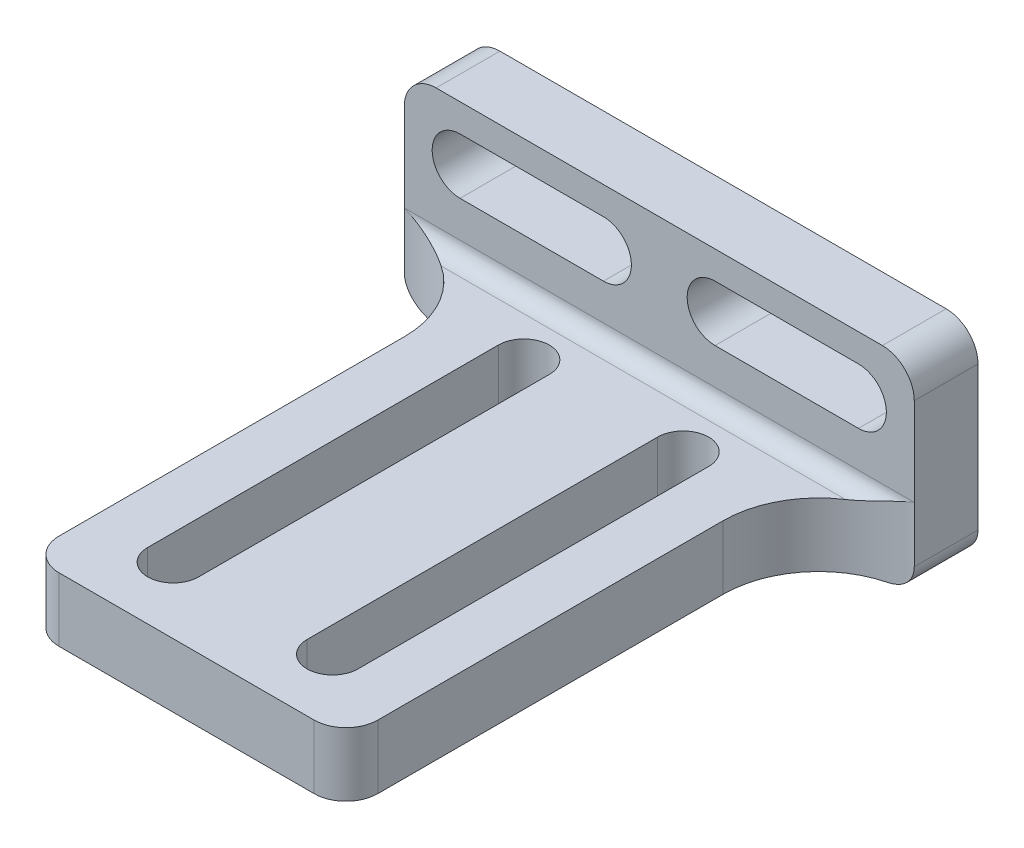
from build123d import *

# Parameters (mm, degrees)
EXTRUDE_1_DEPTH           = 3
SKETCH_7_R                = 2.25
CUT_EXTRUDE_2_DEPTH       = 143.955430949
SKETCH_8_R                = 8
CUT_EXTRUDE_3_DEPTH       = 143.955430949
CUT_EXTRUDE_4_DEPTH       = 3
CUT_EXTRUDE_5_DEPTH       = 3
CUT_EXTRUDE_8_DEPTH       = 3
SKETCH_12_R               = 1.7
CUT_EXTRUDE_9_DEPTH       = 3
SKETCH_13_R               = 1.7
CUT_EXTRUDE_11_DEPTH      = 3
CUT_EXTRUDE_12_DEPTH      = 143.955430949
FILLET_1_R                = 2
FILLET_2_R                = 2
CUT_EXTRUDE_13_DEPTH      = 143.955430949
CUT_EXTRUDE_14_DEPTH      = 143.955430949
CUT_EXTRUDE_15_DEPTH      = 143.955430949
CUT_EXTRUDE_16_DEPTH      = 143.955430949
EXTRUDE_2_DEPTH           = 4
EXTRUDE_2_2_DEPTH         = 4
EXTRUDE_4_DEPTH           = 4
EXTRUDE_5_DEPTH           = 35
SKETCH_25_W               = 6
SKETCH_25_H               = 31
CUT_EXTRUDE_17_DEPTH      = 5
FILLET_3_R                = 6
FILLET_4_R                = 6
FILLET_5_R                = 1.5
FILLET_6_R                = 1.5
CUT_EXTRUDE_18_DEPTH      = 5
CUT_EXTRUDE_19_DEPTH      = 15
CUT_EXTRUDE_19_DEPTH_BACK = 95
SKETCH_27_W               = 31
SKETCH_27_H               = 1
FILLET_8_R                = 1
FILLET_9_R                = 1
FILLET_10_R               = 3
SKETCH_28_W               = 85
SKETCH_28_H               = 10.343066278
CUT_EXTRUDE_20_DEPTH      = 5
FILLET_12_R               = 3
FILLET_13_R               = 3
EXTRUDE_7_DEPTH           = 4
FILLET_14_R               = 2
FILLET_15_R               = 2
SKETCH_33_W               = 46.51678315
SKETCH_33_H               = 37.006685261
CUT_EXTRUDE_22_DEPTH      = 40
SKETCH_34_W               = 20
SKETCH_34_H               = 12
EXTRUDE_8_DEPTH           = 4
CUT_EXTRUDE_23_DEPTH      = 10
FILLET_17_R               = 2


# Read off the part's stored shape, not the designer's step: 切除-拉伸21
# Some blends are built 0.0001 mm under size
with BuildPart() as part:
    # 草图1 → 凸台-拉伸1 (new body)
    # profile 1 of 14: a face of its own
    with BuildSketch(Plane.XY):
        with BuildLine():
            Line((60, 106.603296002), (35.889163634, 121.664519159))
            Line((35.889163634, 121.664519159), (-35.889163634, 121.664519159))
            Line((-35.889163634, 121.664519159), (-60, 106.603296002))
            Line((-60, 106.603296002), (-60, 94.801892265))
            Line((-60, 94.801892265), (-45, 94.801892265))
            ThreePointArc((-45, 94.801892265), (-43.762563133, 94.289329132), (-43.25, 93.051892265))
            Line((-43.25, 93.051892265), (-37.75, 93.051892265))
            ThreePointArc((-37.75, 93.051892265), (-37.237436867, 94.289329132), (-36, 94.801892265))
            Line((-36, 94.801892265), (-21, 94.801892265))
            ThreePointArc((-21, 94.801892265), (-19.762563133, 94.289329132), (-19.25, 93.051892265))
            Line((-19.25, 93.051892265), (19.25, 93.051892265))
            ThreePointArc((19.25, 93.051892265), (19.762563133, 94.289329132), (21, 94.801892265))
            Line((21, 94.801892265), (36, 94.801892265))
            ThreePointArc((36, 94.801892265), (37.237436867, 94.289329132), (37.75, 93.051892265))
            Line((37.75, 93.051892265), (43.25, 93.051892265))
            ThreePointArc((43.25, 93.051892265), (43.762563133, 94.289329132), (45, 94.801892265))
            Line((45, 94.801892265), (60, 94.801892265))
            Line((60, 94.801892265), (60, 106.603296002))
        make_face()
    # profile 2 of 14: a face of its own
    with BuildSketch(Plane.XY):
        with BuildLine():
            Line((66.901694095, 102.292041372), (60, 106.603296002))
            Line((60, 106.603296002), (60, 94.801892265))
            ThreePointArc((60, 94.801892265), (61.237436867, 94.289329132), (61.75, 93.051892265))
            Line((61.75, 93.051892265), (66.901694095, 93.051892265))
            Line((66.901694095, 93.051892265), (66.901694095, 102.292041372))
        make_face()
    # profile 3 of 14: a face of its own
    with BuildSketch(Plane.XY):
        with BuildLine():
            Line((-60, 94.801892265), (-60, 106.603296002))
            Line((-60, 106.603296002), (-66.901694095, 102.292041372))
            Line((-66.901694095, 102.292041372), (-66.901694095, 93.051892265))
            Line((-66.901694095, 93.051892265), (-61.75, 93.051892265))
            ThreePointArc((-61.75, 93.051892265), (-61.237436867, 94.289329132), (-60, 94.801892265))
        make_face()
    # profile 4 of 14: a face of its own
    with BuildSketch(Plane.XY):
        with BuildLine():
            Line((66.901694095, 63.051892265), (66.901694095, 93.051892265))
            Line((66.901694095, 93.051892265), (61.75, 93.051892265))
            ThreePointArc((61.75, 93.051892265), (61.237436867, 91.814455398), (60, 91.301892265))
            Line((60, 91.301892265), (60, 64.801892265))
            ThreePointArc((60, 64.801892265), (61.237436867, 64.289329132), (61.75, 63.051892265))
            Line((61.75, 63.051892265), (66.901694095, 63.051892265))
        make_face()
    # profile 5 of 14: a face of its own
    with BuildSketch(Plane.XY):
        with BuildLine():
            Line((-61.75, 93.051892265), (-66.901694095, 93.051892265))
            Line((-66.901694095, 93.051892265), (-66.901694095, 63.051892265))
            Line((-66.901694095, 63.051892265), (-61.75, 63.051892265))
            ThreePointArc((-61.75, 63.051892265), (-61.237436867, 64.289329132), (-60, 64.801892265))
            Line((-60, 64.801892265), (-60, 91.301892265))
            ThreePointArc((-60, 91.301892265), (-61.237436867, 91.814455398), (-61.75, 93.051892265))
        make_face()
    # profile 6 of 14: a face of its own
    with BuildSketch(Plane.XY):
        with BuildLine():
            Line((66.901694095, 52.870133869), (66.901694095, 63.051892265))
            Line((66.901694095, 63.051892265), (61.75, 63.051892265))
            ThreePointArc((61.75, 63.051892265), (61.237436867, 61.814455398), (60, 61.301892265))
            Line((60, 61.301892265), (60, 31.261343001))
            Line((60, 31.261343001), (75, 31.261343001))
            Line((75, 31.261343001), (75, 40.933889795))
            ThreePointArc((75, 40.933889795), (69.117351927, 45.658052319), (66.901694095, 52.870133869))
        make_face()
    # profile 7 of 14: a face of its own
    with BuildSketch(Plane.XY):
        with BuildLine():
            Line((60, 64.801892265), (60, 91.301892265))
            Line((60, 91.301892265), (45, 91.301892265))
            ThreePointArc((45, 91.301892265), (43.762563133, 91.814455398), (43.25, 93.051892265))
            Line((43.25, 93.051892265), (37.75, 93.051892265))
            ThreePointArc((37.75, 93.051892265), (37.237436867, 91.814455398), (36, 91.301892265))
            Line((36, 91.301892265), (21, 91.301892265))
            ThreePointArc((21, 91.301892265), (19.762563133, 91.814455398), (19.25, 93.051892265))
            Line((19.25, 93.051892265), (-19.25, 93.051892265))
            ThreePointArc((-19.25, 93.051892265), (-19.762563133, 91.814455398), (-21, 91.301892265))
            Line((-21, 91.301892265), (-36, 91.301892265))
            ThreePointArc((-36, 91.301892265), (-37.237436867, 91.814455398), (-37.75, 93.051892265))
            Line((-37.75, 93.051892265), (-43.25, 93.051892265))
            ThreePointArc((-43.25, 93.051892265), (-43.762563133, 91.814455398), (-45, 91.301892265))
            Line((-45, 91.301892265), (-60, 91.301892265))
            Line((-60, 91.301892265), (-60, 64.801892265))
            Line((-60, 64.801892265), (-45, 64.801892265))
            ThreePointArc((-45, 64.801892265), (-43.762563133, 64.289329132), (-43.25, 63.051892265))
            Line((-43.25, 63.051892265), (-37.75, 63.051892265))
            ThreePointArc((-37.75, 63.051892265), (-37.237436867, 64.289329132), (-36, 64.801892265))
            Line((-36, 64.801892265), (-21, 64.801892265))
            ThreePointArc((-21, 64.801892265), (-19.762563133, 64.289329132), (-19.25, 63.051892265))
            Line((-19.25, 63.051892265), (19.25, 63.051892265))
            ThreePointArc((19.25, 63.051892265), (19.762563133, 64.289329132), (21, 64.801892265))
            Line((21, 64.801892265), (36, 64.801892265))
            ThreePointArc((36, 64.801892265), (37.237436867, 64.289329132), (37.75, 63.051892265))
            Line((37.75, 63.051892265), (43.25, 63.051892265))
            ThreePointArc((43.25, 63.051892265), (43.762563133, 64.289329132), (45, 64.801892265))
            Line((45, 64.801892265), (60, 64.801892265))
        make_face()
    # profile 8 of 14: a face of its own
    with BuildSketch(Plane.XY):
        with BuildLine():
            Line((-61.75, 63.051892265), (-66.901694095, 63.051892265))
            Line((-66.901694095, 63.051892265), (-66.901694095, 52.870133869))
            ThreePointArc((-66.901694095, 52.870133869), (-69.117351927, 45.658052319), (-75, 40.933889795))
            Line((-75, 40.933889795), (-75, 31.261343001))
            Line((-75, 31.261343001), (-60, 31.261343001))
            Line((-60, 31.261343001), (-60, 61.301892265))
            ThreePointArc((-60, 61.301892265), (-61.237436867, 61.814455398), (-61.75, 63.051892265))
        make_face()
    # profile 9 of 14: a face of its own
    with BuildSketch(Plane.XY):
        with BuildLine():
            Line((60, 31.261343001), (60, 61.301892265))
            Line((60, 61.301892265), (45, 61.301892265))
            ThreePointArc((45, 61.301892265), (43.762563133, 61.814455398), (43.25, 63.051892265))
            Line((43.25, 63.051892265), (37.75, 63.051892265))
            ThreePointArc((37.75, 63.051892265), (37.237436867, 61.814455398), (36, 61.301892265))
            Line((36, 61.301892265), (21, 61.301892265))
            ThreePointArc((21, 61.301892265), (19.762563133, 61.814455398), (19.25, 63.051892265))
            Line((19.25, 63.051892265), (-19.25, 63.051892265))
            ThreePointArc((-19.25, 63.051892265), (-19.762563133, 61.814455398), (-21, 61.301892265))
            Line((-21, 61.301892265), (-36, 61.301892265))
            ThreePointArc((-36, 61.301892265), (-37.237436867, 61.814455398), (-37.75, 63.051892265))
            Line((-37.75, 63.051892265), (-43.25, 63.051892265))
            ThreePointArc((-43.25, 63.051892265), (-43.762563133, 61.814455398), (-45, 61.301892265))
            Line((-45, 61.301892265), (-60, 61.301892265))
            Line((-60, 61.301892265), (-60, 31.261343001))
            Line((-60, 31.261343001), (60, 31.261343001))
        make_face()
    # profile 10 of 14: a face of its own
    with BuildSketch(Plane.XY):
        with BuildLine():
            Line((60, -58.312864289), (60, 23.940028391))
            Line((60, 23.940028391), (-60, 23.940028391))
            Line((-60, 23.940028391), (-60, -58.312864289))
            Line((-60, -58.312864289), (-45, -58.312864289))
            ThreePointArc((-45, -58.312864289), (-43.25, -60.062864289), (-45, -61.812864289))
            Line((-45, -61.812864289), (-60, -61.812864289))
            Line((-60, -61.812864289), (-60, -88.312864289))
            Line((-60, -88.312864289), (-45, -88.312864289))
            ThreePointArc((-45, -88.312864289), (-43.25, -90.062864289), (-45, -91.812864289))
            Line((-45, -91.812864289), (-60, -91.812864289))
            Line((-60, -91.812864289), (-60, -111.849967256))
            Line((-60, -111.849967256), (-38.845469114, -105.590576733))
            ThreePointArc((-38.845469114, -105.590576733), (-36.037784492, -104.975210108), (-33.17088573, -104.768665882))
            Line((-33.17088573, -104.768665882), (33.17088573, -104.768665882))
            ThreePointArc((33.17088573, -104.768665882), (36.037784492, -104.975210108), (38.845469114, -105.590576733))
            Line((38.845469114, -105.590576733), (60, -111.849967256))
            Line((60, -111.849967256), (60, -91.812864289))
            Line((60, -91.812864289), (45, -91.812864289))
            ThreePointArc((45, -91.812864289), (43.762563133, -91.300301156), (43.25, -90.062864289))
            ThreePointArc((43.25, -90.062864289), (43.762563133, -88.825427422), (45, -88.312864289))
            Line((45, -88.312864289), (60, -88.312864289))
            Line((60, -88.312864289), (60, -61.812864289))
            Line((60, -61.812864289), (45, -61.812864289))
            ThreePointArc((45, -61.812864289), (43.762563133, -61.300301156), (43.25, -60.062864289))
            ThreePointArc((43.25, -60.062864289), (43.762563133, -58.825427422), (45, -58.312864289))
            Line((45, -58.312864289), (60, -58.312864289))
        make_face()
        with BuildLine():
            ThreePointArc((-21, -88.312864289), (-19.762563133, -88.825427422), (-19.25, -90.062864289))
            ThreePointArc((-19.25, -90.062864289), (-19.762563133, -91.300301156), (-21, -91.812864289))
            Line((-21, -91.812864289), (-36, -91.812864289))
            ThreePointArc((-36, -91.812864289), (-37.75, -90.062864289), (-36, -88.312864289))
            Line((-36, -88.312864289), (-21, -88.312864289))
        make_face(mode=Mode.SUBTRACT)
        with BuildLine():
            ThreePointArc((-21, -58.312864289), (-19.762563133, -58.825427422), (-19.25, -60.062864289))
            ThreePointArc((-19.25, -60.062864289), (-19.762563133, -61.300301156), (-21, -61.812864289))
            Line((-21, -61.812864289), (-36, -61.812864289))
            ThreePointArc((-36, -61.812864289), (-37.75, -60.062864289), (-36, -58.312864289))
            Line((-36, -58.312864289), (-21, -58.312864289))
        make_face(mode=Mode.SUBTRACT)
        with BuildLine():
            ThreePointArc((36, -88.312864289), (37.237436867, -88.825427422), (37.75, -90.062864289))
            ThreePointArc((37.75, -90.062864289), (37.237436867, -91.300301156), (36, -91.812864289))
            Line((36, -91.812864289), (21, -91.812864289))
            ThreePointArc((21, -91.812864289), (19.762563133, -91.300301156), (19.25, -90.062864289))
            ThreePointArc((19.25, -90.062864289), (19.762563133, -88.825427422), (21, -88.312864289))
            Line((21, -88.312864289), (36, -88.312864289))
        make_face(mode=Mode.SUBTRACT)
        with BuildLine():
            ThreePointArc((36, -58.312864289), (37.237436867, -58.825427422), (37.75, -60.062864289))
            ThreePointArc((37.75, -60.062864289), (37.237436867, -61.300301156), (36, -61.812864289))
            Line((36, -61.812864289), (21, -61.812864289))
            ThreePointArc((21, -61.812864289), (19.762563133, -61.300301156), (19.25, -60.062864289))
            ThreePointArc((19.25, -60.062864289), (19.762563133, -58.825427422), (21, -58.312864289))
            Line((21, -58.312864289), (36, -58.312864289))
        make_face(mode=Mode.SUBTRACT)
    # profile 11 of 14: a face of its own
    with BuildSketch(Plane.XY):
        with BuildLine():
            Line((75, 23.940028391), (60, 23.940028391))
            Line((60, 23.940028391), (60, -58.312864289))
            ThreePointArc((60, -58.312864289), (61.237436867, -58.825427422), (61.75, -60.062864289))
            Line((61.75, -60.062864289), (67.402721334, -60.062864289))
            add(Edge.make_bspline(
                [(75, 10.562559835), (72.695878257, 1.907314233), (70.339582535, -13.372796253), (67.818206704, -36.939032951), (67.208860388, -51.77269444), (67.402721334, -60.062864289)],
                knots=[0, 0, 0, 0, 0.235246678, 0.40629419, 0.624108181, 0.624108181, 0.624108181, 0.624108181], degree=3))
            Line((75, 10.562559835), (75, 23.940028391))
        make_face()
    # profile 12 of 14: a face of its own
    with BuildSketch(Plane.XY):
        with BuildLine():
            Line((-60, -58.312864289), (-60, 23.940028391))
            Line((-60, 23.940028391), (-75, 23.940028391))
            Line((-75, 23.940028391), (-75, 10.562559835))
            add(Edge.make_bspline(
                [(-75, 10.562559835), (-72.695878257, 1.907314233), (-70.339582535, -13.372796253), (-67.818206704, -36.939032951), (-67.208860388, -51.77269444), (-67.402721334, -60.062864289)],
                knots=[0, 0, 0, 0, 0.235246678, 0.40629419, 0.624108181, 0.624108181, 0.624108181, 0.624108181], degree=3))
            add(Edge.make_bspline(
                [(-67.402721334, -60.062864289), (-67.560325872, -66.802583754), (-68.323504015, -76.843670093), (-70.154131955, -86.778530076), (-70.533712858, -90.062864289)],
                knots=[0.624108181, 0.624108181, 0.624108181, 0.624108181, 0.801186001, 0.888408652, 0.888408652, 0.888408652, 0.888408652], degree=3))
            add(Edge.make_bspline(
                [(-70.533712858, -90.062864289), (-71.019342956, -94.264792095), (-71.137422935, -98.476048206), (-70.1742624, -102.732794059)],
                knots=[0.888408652, 0.888408652, 0.888408652, 0.888408652, 1, 1, 1, 1], degree=3))
            Line((-70.1742624, -102.732794059), (-66.460817635, -113.761651372))
            Line((-66.460817635, -113.761651372), (-60, -111.849967256))
            Line((-60, -111.849967256), (-60, -91.812864289))
            ThreePointArc((-60, -91.812864289), (-61.75, -90.062864289), (-60, -88.312864289))
            Line((-60, -88.312864289), (-60, -61.812864289))
            ThreePointArc((-60, -61.812864289), (-61.75, -60.062864289), (-60, -58.312864289))
        make_face()
    # profile 13 of 14: a face of its own
    with BuildSketch(Plane.XY):
        with BuildLine():
            Line((67.402721334, -60.062864289), (61.75, -60.062864289))
            ThreePointArc((61.75, -60.062864289), (61.237436867, -61.300301156), (60, -61.812864289))
            Line((60, -61.812864289), (60, -88.312864289))
            ThreePointArc((60, -88.312864289), (61.237436867, -88.825427422), (61.75, -90.062864289))
            Line((61.75, -90.062864289), (70.533712858, -90.062864289))
            add(Edge.make_bspline(
                [(67.402721334, -60.062864289), (67.560325872, -66.802583754), (68.323504015, -76.843670093), (70.154131955, -86.778530076), (70.533712858, -90.062864289)],
                knots=[0.624108181, 0.624108181, 0.624108181, 0.624108181, 0.801186001, 0.888408652, 0.888408652, 0.888408652, 0.888408652], degree=3))
        make_face()
    # profile 14 of 14: a face of its own
    with BuildSketch(Plane.XY):
        with BuildLine():
            add(Edge.make_bspline(
                [(70.533712858, -90.062864289), (71.019342956, -94.264792095), (71.137422935, -98.476048206), (70.1742624, -102.732794059)],
                knots=[0.888408652, 0.888408652, 0.888408652, 0.888408652, 1, 1, 1, 1], degree=3))
            Line((70.533712858, -90.062864289), (61.75, -90.062864289))
            ThreePointArc((61.75, -90.062864289), (61.237436867, -91.300301156), (60, -91.812864289))
            Line((60, -91.812864289), (60, -111.849967256))
            Line((60, -111.849967256), (66.460817635, -113.761651372))
            Line((66.460817635, -113.761651372), (70.1742624, -102.732794059))
        make_face()
    extrude(amount=EXTRUDE_1_DEPTH)

    # 草图7 → 切除-拉伸2 (cut, through all)
    with BuildSketch(Plane(origin=(0, 0, 0), x_dir=(-1, 0, 0), z_dir=(0, 0, -1))):
        with Locations((-21, 41.261343001)):
            Circle(SKETCH_7_R)
        with Locations((21, 41.261343001)):
            Circle(SKETCH_7_R)
        with Locations((-21, 13.940028391)):
            Circle(SKETCH_7_R)
        with Locations((21, 13.940028391)):
            Circle(SKETCH_7_R)
    extrude(amount=-CUT_EXTRUDE_2_DEPTH, mode=Mode.SUBTRACT)

    # 草图8 → 切除-拉伸3 (cut, through all)
    with BuildSketch(Plane.XY.offset(3)):
        with BuildLine():
            Line((-12.621438714, -0.378557945), (-33.409010345, 20.409013685))
            ThreePointArc((-33.409010345, 20.409013685), (-36.590999434, 20.409013643), (-36.590999309, 17.227024553))
            Line((-36.590999309, 17.227024553), (-15.803426586, -3.560545984))
            ThreePointArc((-15.803426586, -3.560545984), (-12.621438673, -3.560545859), (-12.621438714, -0.378557945))
        make_face()
        with BuildLine():
            Line((33.410462056, 20.410458798), (12.572988319, -0.427010824))
            ThreePointArc((12.572988319, -0.427010824), (12.644570441, -3.584764993), (15.803045702, -3.56090242))
            Line((15.803045702, -3.56090242), (34.999999982, 15.636052774))
            Line((34.999999982, 15.636052774), (36.588086952, 17.224139819))
            ThreePointArc((36.588086952, 17.224139819), (36.592433993, 20.406111757), (33.410462056, 20.410458798))
        make_face()
        with BuildLine():
            Line((-15.803784812, -28.80377835), (-36.591002186, -49.590991619))
            ThreePointArc((-36.591002186, -49.590991619), (-36.591002403, -52.772972232), (-33.40902179, -52.772972254))
            Line((-33.40902179, -52.772972254), (-12.573723916, -31.937673388))
            ThreePointArc((-12.573723916, -31.937673388), (-12.64530628, -28.779915954), (-15.803784812, -28.80377835))
        make_face()
        with BuildLine():
            Line((36.590992666, -49.590989326), (15.803414627, -28.803411286))
            ThreePointArc((15.803414627, -28.803411286), (12.654338964, -28.769774302), (12.55344336, -31.917412949))
            Line((12.55344336, -31.917412949), (33.409007381, -52.772974779))
            ThreePointArc((33.409007381, -52.772974779), (36.590992708, -52.772974653), (36.590992666, -49.590989326))
        make_face()
        with Locations((-0.000368782, -16.182341354)):
            Circle(SKETCH_8_R)
    extrude(amount=-CUT_EXTRUDE_3_DEPTH, mode=Mode.SUBTRACT)

    # 草图9 → 切除-拉伸4 (cut)
    with BuildSketch(Plane.XY.offset(3)):
        with BuildLine():
            Line((55, -100.49704609), (20, -100.49704609))
            ThreePointArc((20, -100.49704609), (18.25, -98.74704609), (20, -96.99704609))
            Line((20, -96.99704609), (55, -96.99704609))
            ThreePointArc((55, -96.99704609), (56.75, -98.74704609), (55, -100.49704609))
        make_face()
        with BuildLine():
            Line((-55, -96.99704609), (-20, -96.99704609))
            ThreePointArc((-20, -96.99704609), (-18.25, -98.74704609), (-20, -100.49704609))
            Line((-20, -100.49704609), (-55, -100.49704609))
            ThreePointArc((-55, -100.49704609), (-56.75, -98.74704609), (-55, -96.99704609))
        make_face()
    extrude(amount=-CUT_EXTRUDE_4_DEPTH, mode=Mode.SUBTRACT)

    # 草图10 → 切除-拉伸5 (cut)
    with BuildSketch(Plane.XY.offset(3)):
        with BuildLine():
            Line((12.5, -80.062864289), (-12.5, -80.062864289))
            ThreePointArc((-12.5, -80.062864289), (-17.5, -75.062864289), (-12.5, -70.062864289))
            Line((-12.5, -70.062864289), (12.5, -70.062864289))
            ThreePointArc((12.5, -70.062864289), (17.5, -75.062864289), (12.5, -80.062864289))
        make_face()
    extrude(amount=-CUT_EXTRUDE_5_DEPTH, mode=Mode.SUBTRACT)

    # 草图11 → 切除-拉伸8 (cut)
    with BuildSketch(Plane.XY.offset(3)):
        with BuildLine():
            Line((15, 73.051892265), (-15, 73.051892265))
            ThreePointArc((-15, 73.051892265), (-20, 78.051892265), (-15, 83.051892265))
            Line((-15, 83.051892265), (15, 83.051892265))
            ThreePointArc((15, 83.051892265), (20, 78.051892265), (15, 73.051892265))
        make_face()
    extrude(amount=-CUT_EXTRUDE_8_DEPTH, mode=Mode.SUBTRACT)

    # 草图12 → 切除-拉伸9 (cut)
    with BuildSketch(Plane.XY.offset(3)):
        with Locations((0, 114.371786435)):
            Circle(SKETCH_12_R)
        with Locations((0, 98.371786435)):
            Circle(SKETCH_12_R)
        with Locations((8, 106.371786435)):
            Circle(SKETCH_12_R)
        with Locations((-8, 106.371786435)):
            Circle(SKETCH_12_R)
    extrude(amount=-CUT_EXTRUDE_9_DEPTH, mode=Mode.SUBTRACT)

    # 草图13 → 切除-拉伸11 (cut)
    with BuildSketch(Plane.XY.offset(3)):
        with Locations((0, -84.415765086)):
            Circle(SKETCH_13_R)
        with Locations((8, -92.415765086)):
            Circle(SKETCH_13_R)
        with Locations((0, -100.415765086)):
            Circle(SKETCH_13_R)
        with Locations((-8, -92.415765086)):
            Circle(SKETCH_13_R)
    extrude(amount=-CUT_EXTRUDE_11_DEPTH, mode=Mode.SUBTRACT)

    # 草图14 → 切除-拉伸12 (cut, through all)
    with BuildSketch(Plane.XY.offset(3)):
        with BuildLine():
            Line((-55.475501567, 8.919687236), (-55.475501567, -46.080312764))
            ThreePointArc((-55.475501567, -46.080312764), (-57.225501567, -47.830312764), (-58.975501567, -46.080312764))
            Line((-58.975501567, -46.080312764), (-58.975501567, 8.919687236))
            ThreePointArc((-58.975501567, 8.919687236), (-57.225501567, 10.669687236), (-55.475501567, 8.919687236))
        make_face()
        with BuildLine():
            Line((58.975501567, 8.919687236), (58.975501567, -46.080312764))
            ThreePointArc((58.975501567, -46.080312764), (57.225501567, -47.830312764), (55.475501567, -46.080312764))
            Line((55.475501567, -46.080312764), (55.475501567, 8.919687236))
            ThreePointArc((55.475501567, 8.919687236), (57.225501567, 10.669687236), (58.975501567, 8.919687236))
        make_face()
    extrude(amount=-CUT_EXTRUDE_12_DEPTH, mode=Mode.SUBTRACT)

    # 圆角1
    fillet_1_edges = [part.edges().sort_by_distance(p)[0] for p in [
        (75, 31.261343001, 1.5),
        (-75, 31.261343001, 1.5),
    ]]
    fillet(fillet_1_edges, radius=FILLET_1_R)

    # 圆角2
    fillet_2_edges = [part.edges().sort_by_distance(p)[0] for p in [
        (-75, 23.940028391, 1.5),
        (75, 23.940028391, 1.5),
    ]]
    fillet(fillet_2_edges, radius=FILLET_2_R)

    # 草图15 → 切除-拉伸13 (cut, through all)
    with BuildSketch(Plane(origin=(0, 0, 0), x_dir=(-1, 0, 0), z_dir=(0, 0, -1))):
        with BuildLine():
            Line((-61.184216401, 102.403501276), (-34.774762862, 118.900592756))
            ThreePointArc((-34.774762862, 118.900592756), (-32.70788159, 118.423097411), (-33.185376934, 116.356216138))
            Line((-33.185376934, 116.356216138), (-59.594830473, 99.859124658))
            ThreePointArc((-59.594830473, 99.859124658), (-61.661711746, 100.336620003), (-61.184216401, 102.403501276))
        make_face()
        with BuildLine():
            Line((59.594830473, 99.859124658), (33.185376934, 116.356216138))
            ThreePointArc((33.185376934, 116.356216138), (32.70788159, 118.423097411), (34.774762862, 118.900592756))
            Line((34.774762862, 118.900592756), (61.184216401, 102.403501276))
            ThreePointArc((61.184216401, 102.403501276), (61.661711746, 100.336620003), (59.594830473, 99.859124658))
        make_face()
    extrude(amount=-CUT_EXTRUDE_13_DEPTH, mode=Mode.SUBTRACT)

    # 草图16 → 切除-拉伸14 (cut, through all)
    with BuildSketch(Plane(origin=(0, 0, 0), x_dir=(-1, 0, 0), z_dir=(0, 0, -1))):
        with BuildLine():
            Line((-61.516979467, 42.761343001), (-32.056291893, 42.761343001))
            ThreePointArc((-32.056291893, 42.761343001), (-30.556291893, 41.261343001), (-32.056291893, 39.761343001))
            Line((-32.056291893, 39.761343001), (-61.516979467, 39.761343001))
            ThreePointArc((-61.516979467, 39.761343001), (-63.016979467, 41.261343001), (-61.516979467, 42.761343001))
        make_face()
        with BuildLine():
            Line((61.516979467, 39.761343001), (32.056291893, 39.761343001))
            ThreePointArc((32.056291893, 39.761343001), (30.556291893, 41.261343001), (32.056291893, 42.761343001))
            Line((32.056291893, 42.761343001), (61.516979467, 42.761343001))
            ThreePointArc((61.516979467, 42.761343001), (63.016979467, 41.261343001), (61.516979467, 39.761343001))
        make_face()
    extrude(amount=-CUT_EXTRUDE_14_DEPTH, mode=Mode.SUBTRACT)

    # 草图17 → 切除-拉伸15 (cut, through all)
    with BuildSketch(Plane(origin=(0, 0, 0), x_dir=(-1, 0, 0), z_dir=(0, 0, -1))):
        Polygon((-28.645414283, -8.118433382), (-34.644957411, -20.11751964), (-34.644957411, -29.946558382), (-37.580904049, -29.946558382), (-37.580904049, -20.11751964), (-43.580447177, -8.118433382), (-40.64450054, -8.118433382), (-36.176755657, -17.43687271), (-36.049105803, -17.43687271), (-31.58136092, -8.118433382), align=None)
    extrude(amount=-CUT_EXTRUDE_15_DEPTH, mode=Mode.SUBTRACT)

    # 草图18 → 切除-拉伸16 (cut, through all)
    with BuildSketch(Plane(origin=(0, 0, 0), x_dir=(-1, 0, 0), z_dir=(0, 0, -1))):
        Polygon((46.06697123, -29.087529791), (43.131024593, -29.087529791), (43.131024593, -18.875541487), (35.854982926, -18.875541487), (35.854982926, -29.087529791), (32.919036289, -29.087529791), (32.919036289, -7.259404791), (35.854982926, -7.259404791), (35.854982926, -16.450194265), (43.131024593, -16.450194265), (43.131024593, -7.259404791), (46.06697123, -7.259404791), align=None)
    extrude(amount=-CUT_EXTRUDE_16_DEPTH, mode=Mode.SUBTRACT)


with BuildPart() as body_2:
    # 草图19 → 凸台-拉伸2 (new body)
    with BuildSketch(Plane.XY.offset(13)):
        Polygon((16.5, -101.24704609), (16.5, -96.24704609), (48.5, -96.24704609), (48.5, -101.24704609), (48.5, -104.768665882), (16.5, -104.768665882), align=None)
        with BuildLine():
            Line((20, -100.49704609), (45, -100.49704609))
            ThreePointArc((45, -100.49704609), (46.75, -98.74704609), (45, -96.99704609))
            Line((45, -96.99704609), (20, -96.99704609))
            ThreePointArc((20, -96.99704609), (18.25, -98.74704609), (20, -100.49704609))
        make_face(mode=Mode.SUBTRACT)
    extrude(amount=EXTRUDE_2_DEPTH)



with BuildPart() as body_3:
    # 草图19 → Extrude 2 2 (new body)
    with BuildSketch(Plane.XY.offset(13)):
        Polygon((-16.5, -101.24704609), (-16.5, -104.768665882), (-48.5, -104.768665882), (-48.5, -101.24704609), (-48.5, -96.24704609), (-16.5, -96.24704609), align=None)
        with BuildLine():
            Line((-45, -96.99704609), (-20, -96.99704609))
            ThreePointArc((-20, -96.99704609), (-18.25, -98.74704609), (-20, -100.49704609))
            Line((-20, -100.49704609), (-45, -100.49704609))
            ThreePointArc((-45, -100.49704609), (-46.75, -98.74704609), (-45, -96.99704609))
        make_face(mode=Mode.SUBTRACT)
    extrude(amount=EXTRUDE_2_2_DEPTH)


with BuildPart() as body_2_1:
    add(body_2.part)

    add(body_3.part)  # 凸台-拉伸4 merges body 3
    # 草图21 → 凸台-拉伸4 (add)
    with BuildSketch(Plane.XY.offset(17)):
        with BuildLine():
            Line((-36, -96.99704609), (-29, -96.99704609))
            ThreePointArc((-29, -96.99704609), (-30.75, -98.74704609), (-29, -100.49704609))
            Line((-29, -100.49704609), (-36, -100.49704609))
            ThreePointArc((-36, -100.49704609), (-34.25, -98.74704609), (-36, -96.99704609))
        make_face()
        with BuildLine():
            Line((36, -100.49704609), (29, -100.49704609))
            ThreePointArc((29, -100.49704609), (30.75, -98.74704609), (29, -96.99704609))
            Line((29, -96.99704609), (36, -96.99704609))
            ThreePointArc((36, -96.99704609), (34.25, -98.74704609), (36, -100.49704609))
        make_face()
    extrude(amount=-EXTRUDE_4_DEPTH)

    # 草图23 → 凸台-拉伸5 (add)
    with BuildSketch(Plane.XY.offset(13)):
        Polygon((-48.5, -104.768665882), (-48.5, -107.768665882), (-16.5, -107.768665882), (-16.5, -104.768665882), (-16.5, -102.768665882), (-48.5, -102.768665882), align=None)
        Polygon((16.5, -104.768665882), (16.5, -107.768665882), (48.5, -107.768665882), (48.5, -104.768665882), (48.5, -102.768665882), (16.5, -102.768665882), align=None)
    extrude(amount=EXTRUDE_5_DEPTH)

    # 草图25 → 切除-拉伸17 (cut)
    with BuildSketch(Plane(origin=(0, -102.768665882, 0), x_dir=(1, 0, 0), z_dir=(0, 1, 0))):
        with Locations((-19.5, -32.5)):
            Rectangle(SKETCH_25_W, SKETCH_25_H)
        with Locations((-45.5, -32.5)):
            Rectangle(SKETCH_25_W, SKETCH_25_H)
        with Locations((19.5, -32.5)):
            Rectangle(SKETCH_25_W, SKETCH_25_H)
        with Locations((45.5, -32.5)):
            Rectangle(SKETCH_25_W, SKETCH_25_H)
    extrude(amount=-CUT_EXTRUDE_17_DEPTH, mode=Mode.SUBTRACT)

    # 圆角3
    fillet_3_edges = [body_2_1.edges().sort_by_distance(p)[0] for p in [
        (22.5, -105.268665882, 17),
        (42.5, -105.268665882, 17),
    ]]
    fillet(fillet_3_edges, radius=FILLET_3_R - 0.0001)  # a hair under: the kernel refuses the full size

    # 圆角4
    fillet_4_edges = [body_2_1.edges().sort_by_distance(p)[0] for p in [
        (-42.5, -105.268665882, 17),
        (-22.5, -105.268665882, 17),
    ]]
    fillet(fillet_4_edges, radius=FILLET_4_R - 0.0001)  # a hair under: the kernel refuses the full size

    # 圆角5
    fillet_5_edges = [body_2_1.edges().sort_by_distance(p)[0] for p in [
        (16.5, -96.24704609, 15),
        (48.5, -96.24704609, 15),
        (48.5, -107.768665882, 15),
        (16.5, -107.768665882, 15),
    ]]
    fillet(fillet_5_edges, radius=FILLET_5_R)

    # 圆角6
    fillet_6_edges = [body_2_1.edges().sort_by_distance(p)[0] for p in [
        (-48.5, -96.24704609, 15),
        (-16.5, -96.24704609, 15),
        (-16.5, -107.768665882, 15),
        (-48.5, -107.768665882, 15),
    ]]
    fillet(fillet_6_edges, radius=FILLET_6_R)

    # 草图26 → 切除-拉伸18 (cut)
    with BuildSketch(Plane.XZ.offset(107.768665882)):
        with BuildLine():
            Line((35.9, 20.5), (35.9, 32.5))
            ThreePointArc((35.9, 32.5), (37.5, 34.1), (39.1, 32.5))
            Line((39.1, 32.5), (39.1, 20.5))
            ThreePointArc((39.1, 20.5), (37.5, 18.9), (35.9, 20.5))
        make_face()
        with BuildLine():
            Line((25.9, 20.5), (25.9, 32.5))
            ThreePointArc((25.9, 32.5), (27.5, 34.1), (29.1, 32.5))
            Line((29.1, 32.5), (29.1, 20.5))
            ThreePointArc((29.1, 20.5), (27.5, 18.9), (25.9, 20.5))
        make_face()
        with BuildLine():
            Line((-29.1, 20.5), (-29.1, 32.5))
            ThreePointArc((-29.1, 32.5), (-27.5, 34.1), (-25.9, 32.5))
            Line((-25.9, 32.5), (-25.9, 20.5))
            ThreePointArc((-25.9, 20.5), (-27.5, 18.9), (-29.1, 20.5))
        make_face()
        with BuildLine():
            Line((-39.1, 20.5), (-39.1, 32.5))
            ThreePointArc((-39.1, 32.5), (-37.5, 34.1), (-35.9, 32.5))
            Line((-35.9, 32.5), (-35.9, 20.5))
            ThreePointArc((-35.9, 20.5), (-37.5, 18.9), (-39.1, 20.5))
        make_face()
    extrude(amount=-CUT_EXTRUDE_18_DEPTH, mode=Mode.SUBTRACT)

    # 草图27 → 切除-拉伸19 (cut, two sides: drawn at the far end of the back side and taken through both)
    with BuildSketch(Plane(origin=(42.5, 0, 0), x_dir=(0, 0, -1), z_dir=(1, 0, 0)).offset(-CUT_EXTRUDE_19_DEPTH_BACK)):
        with Locations((-32.5, -103.268665882)):
            Rectangle(SKETCH_27_W, SKETCH_27_H)
    extrude(amount=CUT_EXTRUDE_19_DEPTH + CUT_EXTRUDE_19_DEPTH_BACK, mode=Mode.SUBTRACT)

    # 圆角8
    # the kernel refuses this fillet: 1 mm, written as the material it adds along each edge
    with BuildSketch(Plane(origin=(-12.2501, -103.768665882, 17), x_dir=(0, 0, 1), z_dir=(-1, 0, 0))) as fillet_8_piece_1_section:
        with BuildLine():
            CenterArc((FILLET_8_R, FILLET_8_R), FILLET_8_R, 180, 90)
            Line((0, FILLET_8_R), (0, 0))
            Line((0, 0), (FILLET_8_R, 0))
        make_face()
    fillet_8_piece_1 = extrude(amount=40.4998, mode=Mode.PRIVATE)
    fillet_8_piece_1 = split(fillet_8_piece_1, bisect_by=Plane(origin=(-16.5, -103.768665882, 17), z_dir=(-1, 0, 0)), keep=Keep.TOP, mode=Mode.PRIVATE)
    fillet_8_piece_1 = split(fillet_8_piece_1, bisect_by=Plane(origin=(-48.5, -103.768665882, 17), z_dir=(1, 0, 0)), keep=Keep.TOP, mode=Mode.PRIVATE)
    fillet_8_piece_1 = fillet_8_piece_1 - Plane(origin=(-48.4999, -103.768665882, 22.9999), x_dir=(1, 0, 0), z_dir=(0, -1, 0)) * Cylinder(5.9999, 85, mode=Mode.PRIVATE)
    fillet_8_piece_1 = fillet_8_piece_1 - Plane(origin=(-16.5001, -103.768665882, 22.9999), x_dir=(-1, 0, 0), z_dir=(0, -1, 0)) * Cylinder(5.9999, 85, mode=Mode.PRIVATE)
    add(fillet_8_piece_1)

    # 圆角9
    fillet_9_edges = [body_2_1.edges().sort_by_distance(p)[0] for p in [
        (32.5, -103.768665882, 17),
    ]]
    fillet(fillet_9_edges, radius=FILLET_9_R)

    # 圆角10
    fillet_10_edges = [body_2_1.edges().sort_by_distance(p)[0] for p in [
        (-42.5, -105.768665882, 48),
        (-22.5, -105.768665882, 48),
    ]]
    fillet(fillet_10_edges, radius=FILLET_10_R)

    # 草图28 → 切除-拉伸20 (cut)
    with BuildSketch(Plane.XZ.offset(107.768665882)):
        with Locations((0, 42.828466861)):
            Rectangle(SKETCH_28_W, SKETCH_28_H)
    extrude(amount=-CUT_EXTRUDE_20_DEPTH, mode=Mode.SUBTRACT)

    # 圆角12
    fillet_12_edges = [body_2_1.edges().sort_by_distance(p)[0] for p in [
        (22.5, -105.768665882, 37.656933722),
        (42.5, -105.768665882, 37.656933722),
    ]]
    fillet(fillet_12_edges, radius=FILLET_12_R)

    # 圆角13
    fillet_13_edges = [body_2_1.edges().sort_by_distance(p)[0] for p in [
        (-22.5, -105.768665882, 37.656933722),
        (-42.5, -105.768665882, 37.656933722),
    ]]
    fillet(fillet_13_edges, radius=FILLET_13_R)

    # 草图32 → 凸台-拉伸7 (add)
    with BuildSketch(Plane(origin=(0, 0, 13), x_dir=(-1, 0, 0), z_dir=(0, 0, -1))):
        with BuildLine():
            Line((-48.5, -97.74704609), (-46.436140662, -97.74704609))
            ThreePointArc((-46.436140662, -97.74704609), (-45.810092587, -97.195836884), (-45, -96.99704609))
            Line((-45, -96.99704609), (-36, -96.99704609))
            ThreePointArc((-36, -96.99704609), (-35.189907413, -97.195836884), (-34.563859338, -97.74704609))
            Line((-34.563859338, -97.74704609), (-30.436140662, -97.74704609))
            ThreePointArc((-30.436140662, -97.74704609), (-29.810092587, -97.195836884), (-29, -96.99704609))
            Line((-29, -96.99704609), (-20, -96.99704609))
            ThreePointArc((-20, -96.99704609), (-19.189907413, -97.195836884), (-18.563859338, -97.74704609))
            Line((-18.563859338, -97.74704609), (-16.5, -97.74704609))
            Line((-16.5, -97.74704609), (-16.5, -95.24704609))
            Line((-16.5, -95.24704609), (-48.5, -95.24704609))
            Line((-48.5, -95.24704609), (-48.5, -97.74704609))
        make_face()
        with BuildLine():
            Line((18.563859338, -97.74704609), (16.5, -97.74704609))
            Line((16.5, -97.74704609), (16.5, -95.24704609))
            Line((16.5, -95.24704609), (48.5, -95.24704609))
            Line((48.5, -95.24704609), (48.5, -97.74704609))
            Line((48.5, -97.74704609), (46.436140662, -97.74704609))
            ThreePointArc((46.436140662, -97.74704609), (45.810092587, -97.195836884), (45, -96.99704609))
            Line((45, -96.99704609), (36, -96.99704609))
            ThreePointArc((36, -96.99704609), (35.189907413, -97.195836884), (34.563859338, -97.74704609))
            Line((34.563859338, -97.74704609), (30.436140662, -97.74704609))
            ThreePointArc((30.436140662, -97.74704609), (29.810092587, -97.195836884), (29, -96.99704609))
            Line((29, -96.99704609), (20, -96.99704609))
            ThreePointArc((20, -96.99704609), (19.189907413, -97.195836884), (18.563859338, -97.74704609))
        make_face()
    extrude(amount=-EXTRUDE_7_DEPTH)

    # 圆角14
    fillet_14_edges = [body_2_1.edges().sort_by_distance(p)[0] for p in [
        (48.5, -95.24704609, 15),
        (16.5, -95.24704609, 15),
    ]]
    fillet(fillet_14_edges, radius=FILLET_14_R)

    # 圆角15
    fillet_15_edges = [body_2_1.edges().sort_by_distance(p)[0] for p in [
        (-16.5, -95.24704609, 15),
        (-48.5, -95.24704609, 15),
    ]]
    fillet(fillet_15_edges, radius=FILLET_15_R)

    # 草图33 → 切除-拉伸22 (cut)
    with BuildSketch(Plane.XZ.offset(107.768665882)):
        with Locations((-31.993209744, 26.20711721)):
            Rectangle(SKETCH_33_W, SKETCH_33_H)
    extrude(amount=-CUT_EXTRUDE_22_DEPTH, mode=Mode.SUBTRACT)

    # 草图34 → 凸台-拉伸8 (add)
    with BuildSketch(Plane.XZ.offset(107.768665882)):
        with Locations((32.5, 40.656933722)):
            Rectangle(SKETCH_34_W, SKETCH_34_H)
    extrude(amount=-EXTRUDE_8_DEPTH)

    # 草图35 → 切除-拉伸23 (cut)
    with BuildSketch(Plane.XZ.offset(107.768665882)):
        with BuildLine():
            Line((39.1, 32.5), (39.1, 42.5))
            ThreePointArc((39.1, 42.5), (37.5, 44.1), (35.9, 42.5))
            Line((35.9, 42.5), (35.9, 32.5))
            ThreePointArc((35.9, 32.5), (37.5, 30.9), (39.1, 32.5))
        make_face()
        with BuildLine():
            Line((29.1, 32.5), (29.1, 42.5))
            ThreePointArc((29.1, 42.5), (27.5, 44.1), (25.9, 42.5))
            Line((25.9, 42.5), (25.9, 32.5))
            ThreePointArc((25.9, 32.5), (27.5, 30.9), (29.1, 32.5))
        make_face()
    extrude(amount=-CUT_EXTRUDE_23_DEPTH, mode=Mode.SUBTRACT)

    # 圆角17
    fillet_17_edges = [body_2_1.edges().sort_by_distance(p)[0] for p in [
        (42.5, -105.768665882, 46.656933722),
        (22.5, -105.768665882, 46.656933722),
    ]]
    fillet(fillet_17_edges, radius=FILLET_17_R)


solid = body_2_1.part
